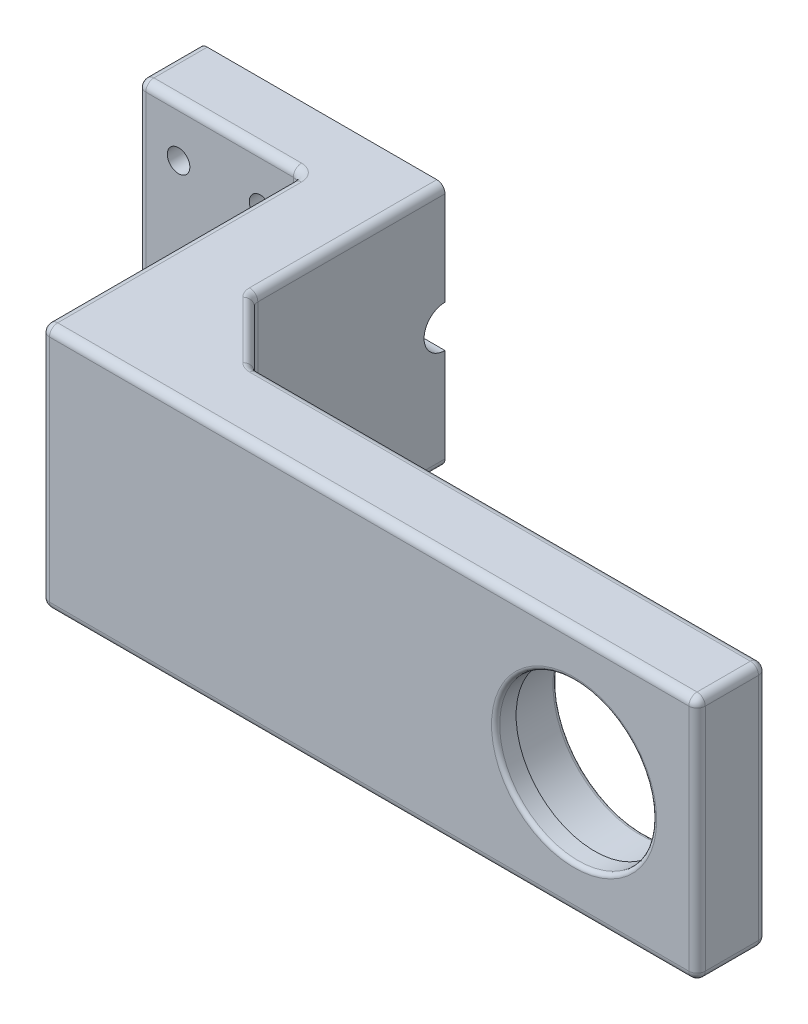
from build123d import *

# Parameters (mm, degrees)
SKETCH1_W               = 60
SKETCH1_H               = 60
SKETCH1_R               = 21.15
BOSS_EXTRUDE1_DEPTH     = 12
SKETCH2_W               = 60
SKETCH2_H               = 60
SKETCH2_R               = 19.15
BOSS_EXTRUDE2_DEPTH     = 5
BOSS_EXTRUDE3_DEPTH     = 30
SKETCH4_W               = 15
SKETCH4_H               = 60
BOSS_EXTRUDE4_DEPTH     = 40
CUT_EXTRUDE1_DEPTH      = 212.381763641
CUT_EXTRUDE1_DEPTH_BACK = 212.381763641
SKETCH5_R               = 5.1
SKETCH6_R               = 2.75
CUT_EXTRUDE2_DEPTH      = 184.935450634
CHAMFER1_SIZE           = 15
FILLET1_R               = 1
FILLET2_R               = 1
FILLET3_R               = 2


with BuildPart() as part:
    # Sketch1 → Boss-Extrude1 (new body)
    with BuildSketch(Plane.XY):
        Rectangle(SKETCH1_W, SKETCH1_H)
        Circle(SKETCH1_R, mode=Mode.SUBTRACT)
    extrude(amount=BOSS_EXTRUDE1_DEPTH)

    # Sketch2 → Boss-Extrude2 (add)
    with BuildSketch(Plane.XY.offset(12)):
        Rectangle(SKETCH2_W, SKETCH2_H)
        Circle(SKETCH2_R, mode=Mode.SUBTRACT)
    extrude(amount=BOSS_EXTRUDE2_DEPTH)

    # Sketch3 → Boss-Extrude3 (add, symmetric)
    with BuildSketch(Plane(origin=(0, 0, 0), x_dir=(1, 0, 0), z_dir=(0, 1, 0))):
        Polygon((-30, 0), (-110, 0), (-110, 61.5), (-130, 61.5), (-130, -17), (-30, -17), align=None)
    extrude(amount=BOSS_EXTRUDE3_DEPTH, both=True)

    # Sketch4 → Boss-Extrude4 (add)
    with BuildSketch(Plane.ZY.offset(130)):
        with Locations((-54, 0)):
            Rectangle(SKETCH4_W, SKETCH4_H)
    extrude(amount=BOSS_EXTRUDE4_DEPTH)

    # Sketch5 → Cut-Extrude1 (cut, two sides: drawn at the far end of the back side and taken through both)
    with BuildSketch(Plane.ZY.offset(170).offset(-CUT_EXTRUDE1_DEPTH_BACK)):
        with Locations((-61.5, 0)):
            Circle(SKETCH5_R)
    extrude(amount=CUT_EXTRUDE1_DEPTH + CUT_EXTRUDE1_DEPTH_BACK, mode=Mode.SUBTRACT)

    # Sketch6 → Cut-Extrude2 (cut, through all)
    with BuildSketch(Plane.XY.offset(-46.5)):
        with Locations((-140, 17.5)):
            Circle(SKETCH6_R)
        with Locations((-140, -17.5)):
            Circle(SKETCH6_R)
        with Locations((-160, -17.5)):
            Circle(SKETCH6_R)
        with Locations((-160, 17.5)):
            Circle(SKETCH6_R)
    extrude(amount=-CUT_EXTRUDE2_DEPTH, mode=Mode.SUBTRACT)

    # Chamfer1
    chamfer1_edges = [part.edges().sort_by_distance(p)[0] for p in [
        (-110, 0, 0),
    ]]
    chamfer(chamfer1_edges, length=CHAMFER1_SIZE)

    # Fillet1
    fillet1_edges = [part.edges().sort_by_distance(p)[0] for p in [
        (-21.15, 0, 0),
    ]]
    fillet(fillet1_edges, radius=FILLET1_R)

    # Fillet2
    fillet2_edges = [part.edges().sort_by_distance(p)[0] for p in [
        (-19.15, 0, 17),
    ]]
    fillet(fillet2_edges, radius=FILLET2_R)

    # Fillet3
    fillet3_edges = [part.edges().sort_by_distance(p)[0] for p in [
        (-150, 30, -46.5),
        (-150, -30, -46.5),
        (-102.5, 30, -7.5),
        (-102.5, -30, -7.5),
        (-130, 30, -14.75),
        (-130, -30, -14.75),
        (-130, 0, -46.5),
        (30, 0, 17),
        (-50, -30, 17),
        (-130, 0, 17),
        (-50, 30, 17),
        (-110, -30, -38.25),
        (-110, 0, -15),
        (-110, 30, -38.25),
        (30, 0, 0),
        (-32.5, 30, 0),
        (-95, 0, 0),
        (-32.5, -30, 0),
        (30, -30, 8.5),
        (30, 30, 8.5),
        (-170, -30, -54),
        (-170, 30, -54),
        (-170, 0, -46.5),
    ]]
    fillet(fillet3_edges, radius=FILLET3_R)


solid = part.part
